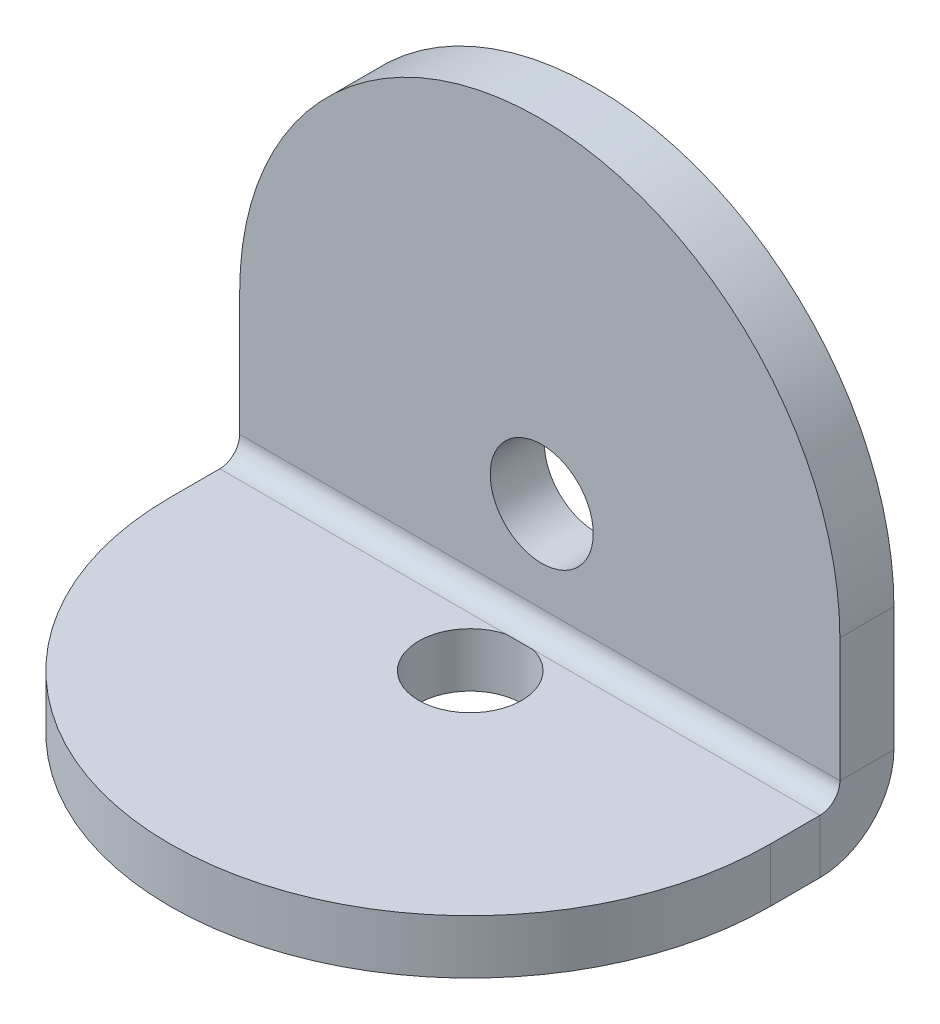
from build123d import *

# Parameters (mm, degrees)
BASE_FLANGE1_DEPTH       = 1.99898
SKETCHED_START           = -17
SKETCHED_BEND1_OUTLINE_W = 22.201670932
SKETCHED_BEND1_OUTLINE_H = 1.99898
SKETCHED_BEND1_DEPTH     = 17.02505456
SKETCHED_START_2         = 0.266062511
SKETCHED_BEND1_2_DEPTH   = 1.732917489
SKETCHED_BEND1_3_DEPTH   = 2.73558
SKETCHED_START_3         = -7.17537008
SKETCHED_BEND1_4_DEPTH   = 22.201670932
SKETCH21_W               = 1.905
SKETCH21_H               = 1.99898
SKETCH17_R               = 1.905
CUT_EXTRUDE4_DEPTH       = 2.54


with BuildPart() as part:
    # Base-Flange1: sheet metal written as solids
    # Sketch1 → Base-Flange1 (new body)
    with BuildSketch(Plane(origin=(0, 0, 0), x_dir=(1, 0, 0), z_dir=(0, 1, 0))):
        with BuildLine():
            Line((15.026300852, -4.572), (15.026300852, 4.572))
            ThreePointArc((15.026300852, 4.572), (3.925465386, 15.672835466), (-7.17537008, 4.572))
            Line((-7.17537008, 4.572), (-7.17537008, -4.572))
            ThreePointArc((-7.17537008, -4.572), (3.925465386, -15.672835466), (15.026300852, -4.572))
        make_face()
    extrude(amount=-BASE_FLANGE1_DEPTH)

    # Sketched Bend1: read off the stored shape, not the designer's step
    # Sketched Bend1 outline → Sketched Bend1 (cut)
    with BuildSketch(Plane.XY.offset(SKETCHED_START)):
        with Locations((3.925465386, -0.99949)):
            Rectangle(SKETCHED_BEND1_OUTLINE_W, SKETCHED_BEND1_OUTLINE_H)
    extrude(amount=SKETCHED_BEND1_DEPTH, mode=Mode.SUBTRACT)

    # Sketched Bend1 2 outline → Sketched Bend1 2 (add)
    with BuildSketch(Plane.XY.offset(SKETCHED_START_2)):
        with BuildLine():
            Line((15.026300852, 0), (15.026300852, 5.317136205))
            ThreePointArc((15.026300852, 5.317136205), (3.925465386, 16.417971671), (-7.17537008, 5.317136205))
            Line((-7.17537008, 5.317136205), (-7.17537008, 0))
            Line((-7.17537008, 0), (15.026300852, 0))
        make_face()
    extrude(amount=SKETCHED_BEND1_2_DEPTH)

    # Sketched Bend1 3 outline → Sketched Bend1 3 (add)
    with BuildSketch(Plane.XY):
        with BuildLine():
            Line((15.026300852, 0), (15.026300852, 5.317136205))
            ThreePointArc((15.026300852, 5.317136205), (3.925465386, 16.417971671), (-7.17537008, 5.317136205))
            Line((-7.17537008, 5.317136205), (-7.17537008, 0))
            Line((-7.17537008, 0), (15.026300852, 0))
        make_face()
    extrude(amount=SKETCHED_BEND1_3_DEPTH)

    # Sketched Bend1 4 outline → Sketched Bend1 4 (cut)
    with BuildSketch(Plane.YZ.offset(SKETCHED_START_3)):
        with BuildLine():
            ThreePointArc((0, 2.73558), (0.215745145, 2.214725145), (0.7366, 1.99898))
            Line((0.7366, 1.99898), (18, 1.99898))
            Line((18, 1.99898), (18, 2.73558))
            Line((18, 2.73558), (0, 2.73558))
        make_face()
        with BuildLine():
            Line((18, -2), (18, -1e-08))
            Line((18, -1e-08), (0.7366, 0))
            ThreePointArc((0.7366, 0), (-1.197747168, 0.801232832), (-1.99898, 2.73558))
            Line((-1.99898, 2.73558), (-1.99898, 0.02505456))
            Line((-1.99898, 0.02505456), (0, 0.02505456))
            Line((0, 0.02505456), (0, -2))
            Line((0, -2), (18, -2))
        make_face()
    extrude(amount=SKETCHED_BEND1_4_DEPTH, mode=Mode.SUBTRACT)

    # Sketch21 → Hole1 (revolve, cut)
    with BuildSketch(Plane(origin=(3.925465386, 0, 4.572), x_dir=(0, 0, 1), z_dir=(1, 0, 0))):
        with Locations((0.9525, 0.99949)):
            Rectangle(SKETCH21_W, SKETCH21_H)
    revolve(axis=Axis((3.925465386, -110, 4.572), (0, 1, 0)), mode=Mode.SUBTRACT)

    # Sketch17 → Cut-Extrude4 (cut)
    with BuildSketch(Plane.XY.offset(1.99898)):
        with Locations((3.997762003, 4.09330652)):
            Circle(SKETCH17_R)
    extrude(amount=-CUT_EXTRUDE4_DEPTH, mode=Mode.SUBTRACT)


solid = part.part
